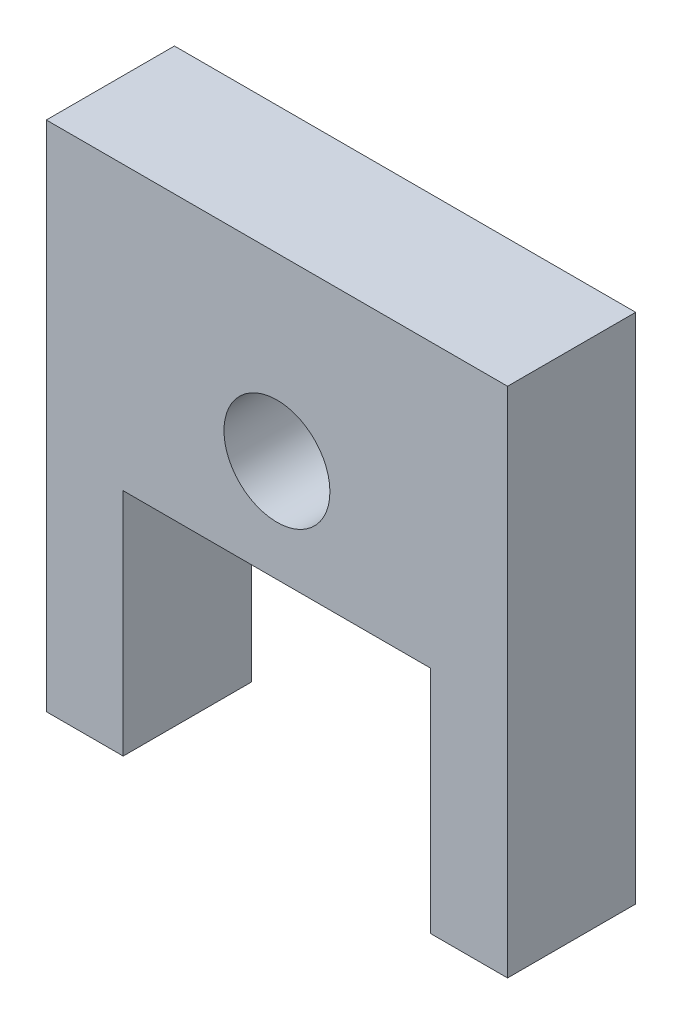
from build123d import *

# Parameters (mm, degrees)
BOSS_EXTRUDE1_DEPTH = 5
SKETCH3_R           = 2.0675
CUT_EXTRUDE1_DEPTH  = 28.367864367


with BuildPart() as part:
    # Sketch1 → Boss-Extrude1 (new body)
    with BuildSketch(Plane.XY):
        Polygon((0, 0), (3, 0), (3, 8.97), (15, 8.97), (15, 0), (18, 0), (18, 20), (0, 20), align=None)
    extrude(amount=BOSS_EXTRUDE1_DEPTH)

    # Sketch3 → Cut-Extrude1 (cut, through all)
    with BuildSketch(Plane.XY.offset(5)):
        with Locations((9, 12.97)):
            Circle(SKETCH3_R)
    extrude(amount=-CUT_EXTRUDE1_DEPTH, mode=Mode.SUBTRACT)


solid = part.part
